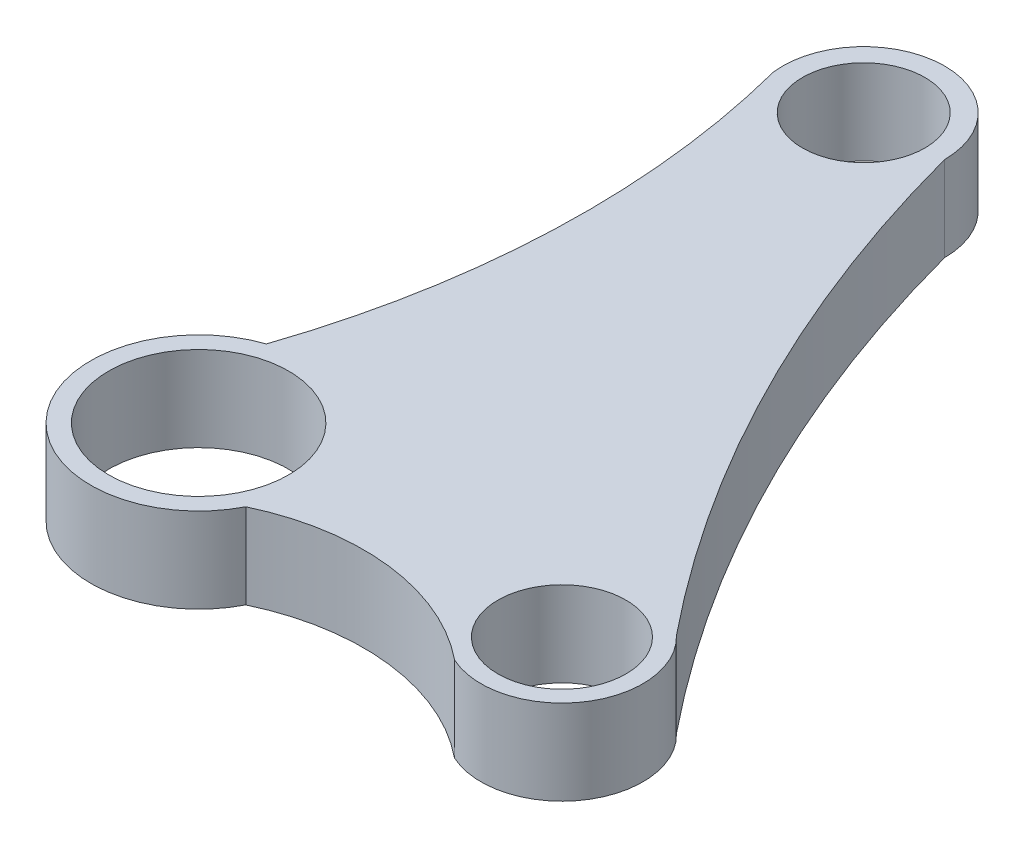
from build123d import *

# Parameters (mm, degrees)
SKETCH1_R           = 10.587882435
SKETCH1_R_2         = 7.199480632
SKETCH1_R_3         = 7.531788478
BOSS_EXTRUDE1_DEPTH = 10


with BuildPart() as part:
    # Sketch1 → Boss-Extrude1 (new body)
    with BuildSketch(Plane(origin=(0, 0, 0), x_dir=(1, 0, 0), z_dir=(0, 1, 0))):
        with BuildLine():
            ThreePointArc((-4.064323901, 12.032093385), (-9.609161718, -8.303855194), (11.315790364, -5.765664614))
            ThreePointArc((11.315790364, -5.765664614), (25.740249478, -3.394175266), (39.201170074, -9.094403262))
            ThreePointArc((39.201170074, -9.094403262), (51.059511196, -5.787458182), (49.751485572, 6.453669581))
            ThreePointArc((49.751485572, 6.453669581), (30.012953097, 36.866674634), (17.037267645, 70.722133981))
            ThreePointArc((17.037267645, 70.722133981), (6.924349436, 80.228972424), (-1.940155384, 69.548539559))
            ThreePointArc((-1.940155384, 69.548539559), (1.196836486, 40.6352383), (-4.064323901, 12.032093385))
        make_face()
        Circle(SKETCH1_R, mode=Mode.SUBTRACT)
        with Locations((7.512267645, 70.722133981)):
            Circle(SKETCH1_R_2, mode=Mode.SUBTRACT)
        with Locations((43.17776617, -0.439213577)):
            Circle(SKETCH1_R_3, mode=Mode.SUBTRACT)
    extrude(amount=BOSS_EXTRUDE1_DEPTH)


solid = part.part
